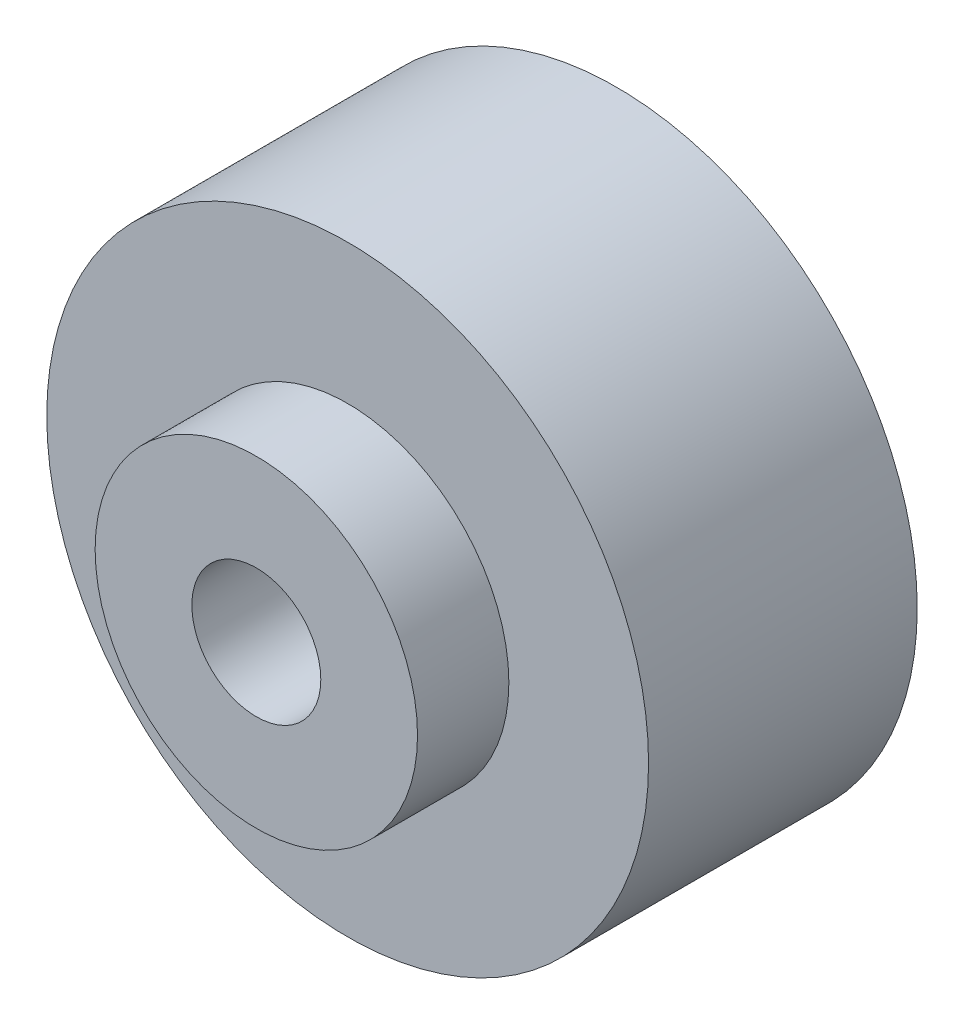
from build123d import *

# Parameters (mm, degrees)
SKETCH1_R           = 15
SKETCH1_R_2         = 6
BOSS_EXTRUDE1_DEPTH = 8.5
SKETCH1_3_R         = 28
SKETCH1_3_R_2       = 6
BOSS_EXTRUDE2_DEPTH = 25


with BuildPart() as part:
    # Sketch1 → Boss-Extrude1 (new body)
    with BuildSketch(Plane.XY):
        Circle(SKETCH1_R)
        Circle(SKETCH1_R_2, mode=Mode.SUBTRACT)
    extrude(amount=BOSS_EXTRUDE1_DEPTH)


with BuildPart() as body_2:
    # Sketch1<3> → Boss-Extrude2 (new body)
    with BuildSketch(Plane.XY):
        Circle(SKETCH1_3_R)
        Circle(SKETCH1_3_R_2, mode=Mode.SUBTRACT)
    extrude(amount=-BOSS_EXTRUDE2_DEPTH)


solid = Compound([part.part, body_2.part])
